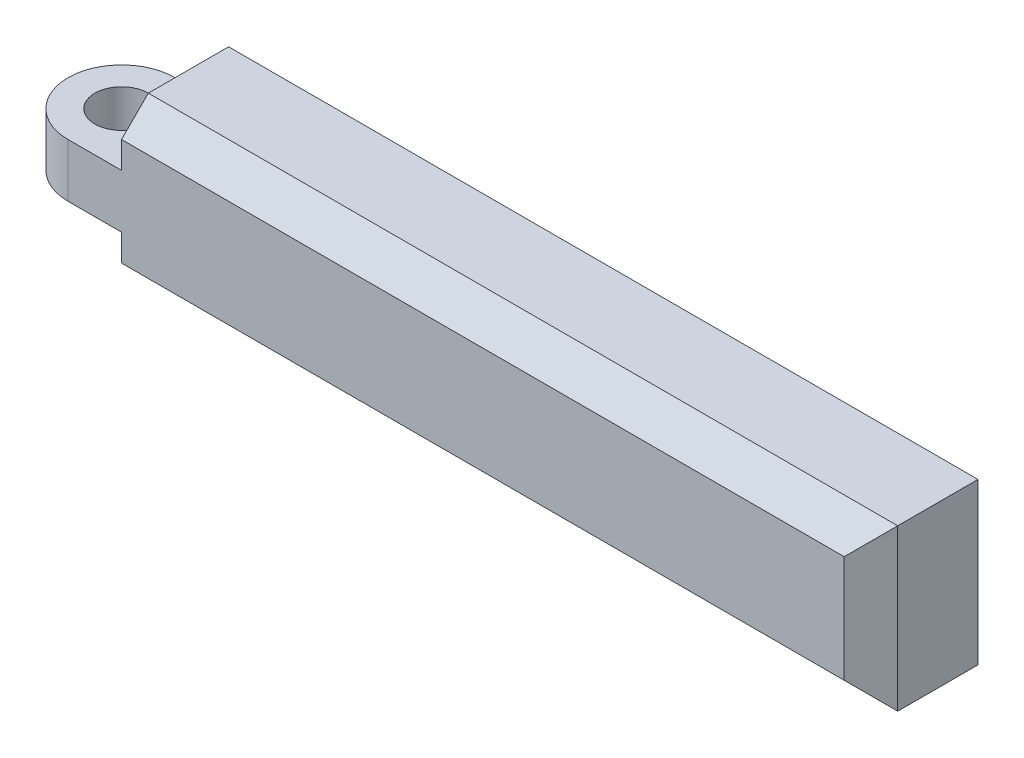
from build123d import *

# Parameters (mm, degrees)
SKETCH1_W           = 14
SKETCH1_H           = 2
BOSS_EXTRUDE1_DEPTH = 3
CHAMFER1_SIZE       = 0.5
SKETCH2_W           = 2
SKETCH2_H           = 1
BOSS_EXTRUDE2_DEPTH = 2
SKETCH3_R           = 0.5
CUT_EXTRUDE1_DEPTH  = 2


with BuildPart() as part:
    # Sketch1 → Boss-Extrude1 (new body)
    with BuildSketch(Plane(origin=(0, 0, 0), x_dir=(1, 0, 0), z_dir=(0, 1, 0))):
        Rectangle(SKETCH1_W, SKETCH1_H)
    extrude(amount=BOSS_EXTRUDE1_DEPTH)

    # Chamfer1
    chamfer1_edges = [part.edges().sort_by_distance(p)[0] for p in [
        (0, 0, -1),
        (7, 1.5, -1),
        (0, 3, -1),
    ]]
    chamfer(chamfer1_edges, length=CHAMFER1_SIZE)

    # Sketch2 → Boss-Extrude2 (add)
    with BuildSketch(Plane.ZY.offset(7)):
        with Locations((0, 1.5)):
            Rectangle(SKETCH2_W, SKETCH2_H)
    extrude(amount=BOSS_EXTRUDE2_DEPTH)

    # Sketch3 → Cut-Extrude1 (cut)
    with BuildSketch(Plane(origin=(0, 2, 0), x_dir=(1, 0, 0), z_dir=(0, 1, 0))):
        with BuildLine():
            Line((-9, -1), (-8, -1))
            ThreePointArc((-8, -1), (-8.707106781, -0.707106781), (-9, 0))
            Line((-9, 0), (-9, -1))
        make_face()
        with BuildLine():
            ThreePointArc((-9, 0), (-8.707106781, 0.707106781), (-8, 1))
            Line((-8, 1), (-9, 1))
            Line((-9, 1), (-9, 0))
        make_face()
        with Locations((-8, 0)):
            Circle(SKETCH3_R)
    extrude(amount=-CUT_EXTRUDE1_DEPTH, mode=Mode.SUBTRACT)


with BuildPart() as body_2:
    # Mirror1: mirrored copy
    add(part.part.mirror(Plane(origin=(-7, 3, -1), x_dir=(1, 0, 0), z_dir=(0, 0, 1))))


solid = body_2.part
